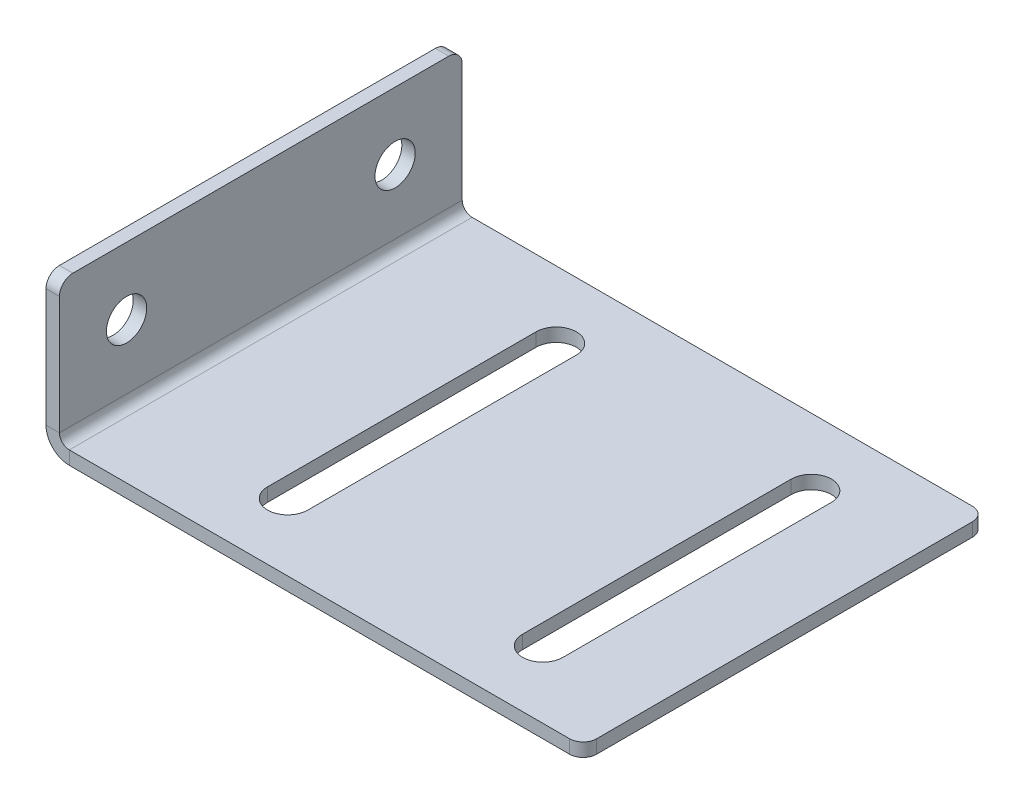
from build123d import *

# Parameters (mm, degrees)
SKETCH_1_R             = 1.5
SM_BASE_FLANGE_1_DEPTH = 1
OTHER_START            = -25
OTHER_1_OUTLINE_W      = 1
OTHER_1_OUTLINE_H      = 30
OTHER_1_DEPTH          = 10
OTHER_START_2          = -14.831098284
OTHER_1_2_OUTLINE_R    = 1.5
OTHER_1_2_DEPTH        = 0.831098284
OTHER_START_3          = -15
OTHER_1_3_OUTLINE_R    = 1.5
OTHER_1_3_DEPTH        = 1.7366
OTHER_1_4_DEPTH        = 30


with BuildPart() as part:
    # 基体-法兰1: sheet metal written as solids
    # Sketch 1 → 基体-法兰1 (new body)
    with BuildSketch(Plane(origin=(0, 0, 0), x_dir=(1, 0, 0), z_dir=(0, 1, 0))):
        with BuildLine():
            Line((-24, 15), (24, 15))
            ThreePointArc((24, 15), (24.707106781, 14.707106781), (25, 14))
            Line((25, 14), (25, -14))
            ThreePointArc((25, -14), (24.707106781, -14.707106781), (24, -15))
            Line((24, -15), (-24, -15))
            ThreePointArc((-24, -15), (-24.707106781, -14.707106781), (-25, -14))
            Line((-25, -14), (-25, 14))
            ThreePointArc((-25, 14), (-24.707106781, 14.707106781), (-24, 15))
        make_face()
        with Locations(Location((-20, -10, 0), (0, 0, 270))):
            Circle(SKETCH_1_R, mode=Mode.SUBTRACT)
        with Locations(Location((-20, 10, 0), (0, 0, 270))):
            Circle(SKETCH_1_R, mode=Mode.SUBTRACT)
        with BuildLine():
            Line((-3.5, -10), (-3.5, 10))
            ThreePointArc((-3.5, 10), (-2, 11.5), (-0.5, 10))
            Line((-0.5, 10), (-0.5, -10))
            ThreePointArc((-0.5, -10), (-2, -11.5), (-3.5, -10))
        make_face(mode=Mode.SUBTRACT)
        with BuildLine():
            Line((15.5, -10), (15.5, 10))
            ThreePointArc((15.5, 10), (17, 11.5), (18.5, 10))
            Line((18.5, 10), (18.5, -10))
            ThreePointArc((18.5, -10), (17, -11.5), (15.5, -10))
        make_face(mode=Mode.SUBTRACT)
    extrude(amount=-SM_BASE_FLANGE_1_DEPTH)

    # Other 1: read off the stored shape, not the designer's step
    # Other 1 outline → Other 1 (cut)
    with BuildSketch(Plane.YZ.offset(OTHER_START)):
        with Locations((-0.5, 0)):
            Rectangle(OTHER_1_OUTLINE_W, OTHER_1_OUTLINE_H)
    extrude(amount=OTHER_1_DEPTH, mode=Mode.SUBTRACT)

    # Other 1 2 outline → Other 1 2 (add)
    with BuildSketch(Plane.YZ.offset(OTHER_START_2)):
        with BuildLine():
            ThreePointArc((10.530753262, 14), (10.237860043, 14.707106781), (9.530753262, 15))
            Line((9.530753262, 15), (0, 15))
            Line((0, 15), (0, -15))
            Line((0, -15), (9.530753262, -15))
            ThreePointArc((9.530753262, -15), (10.237860043, -14.707106781), (10.530753262, -14))
            Line((10.530753262, -14), (10.530753262, 14))
        make_face()
        with Locations((5.530753262, -10)):
            Circle(OTHER_1_2_OUTLINE_R, mode=Mode.SUBTRACT)
        with Locations((5.530753262, 10)):
            Circle(OTHER_1_2_OUTLINE_R, mode=Mode.SUBTRACT)
    extrude(amount=OTHER_1_2_DEPTH)

    # Other 1 3 outline → Other 1 3 (add)
    with BuildSketch(Plane.YZ.offset(OTHER_START_3)):
        with BuildLine():
            ThreePointArc((10.530753262, 14), (10.237860043, 14.707106781), (9.530753262, 15))
            Line((9.530753262, 15), (0, 15))
            Line((0, 15), (0, -15))
            Line((0, -15), (9.530753262, -15))
            ThreePointArc((9.530753262, -15), (10.237860043, -14.707106781), (10.530753262, -14))
            Line((10.530753262, -14), (10.530753262, 14))
        make_face()
        with Locations((5.530753262, -10)):
            Circle(OTHER_1_3_OUTLINE_R, mode=Mode.SUBTRACT)
        with Locations((5.530753262, 10)):
            Circle(OTHER_1_3_OUTLINE_R, mode=Mode.SUBTRACT)
    extrude(amount=OTHER_1_3_DEPTH)

    # Other 1 4 outline → Other 1 4 (cut)
    with BuildSketch(Plane.XY.offset(OTHER_START_3)):
        with BuildLine():
            ThreePointArc((-13.2634, -1), (-14.491361636, -0.491361636), (-15, 0.7366))
            Line((-15, 0.7366), (-15, -1))
            Line((-15, -1), (-13.2634, -1))
        make_face()
        with BuildLine():
            Line((-14, 10.530753262), (-14, 0.7366))
            ThreePointArc((-14, 0.7366), (-13.784254855, 0.215745145), (-13.2634, 0))
            Line((-13.2634, 0), (-13.2634, 10.530753262))
            Line((-13.2634, 10.530753262), (-14, 10.530753262))
        make_face()
    extrude(amount=OTHER_1_4_DEPTH, mode=Mode.SUBTRACT)


solid = part.part
